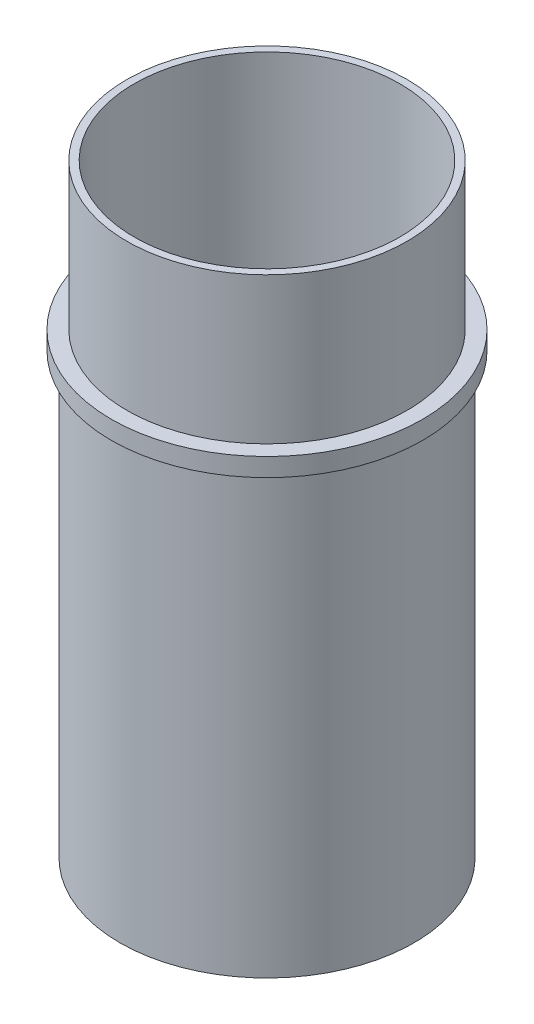
from build123d import *


with BuildPart() as part:
    # Sketch1 → Revolve1 (revolve)
    with BuildSketch(Plane.XY):
        Polygon((23.040312493, 78.961527288), (23.040312493, -25.813472712), (25.5143, -25.813472712), (25.5143, 50.386527288), (26.9875, 50.386527288), (26.9875, 53.561527288), (24.310312493, 53.561527288), (24.310312493, 78.961527288), align=None)
    revolve(axis=Axis((0, 0, 0), (0, 1, 0)))


solid = part.part
